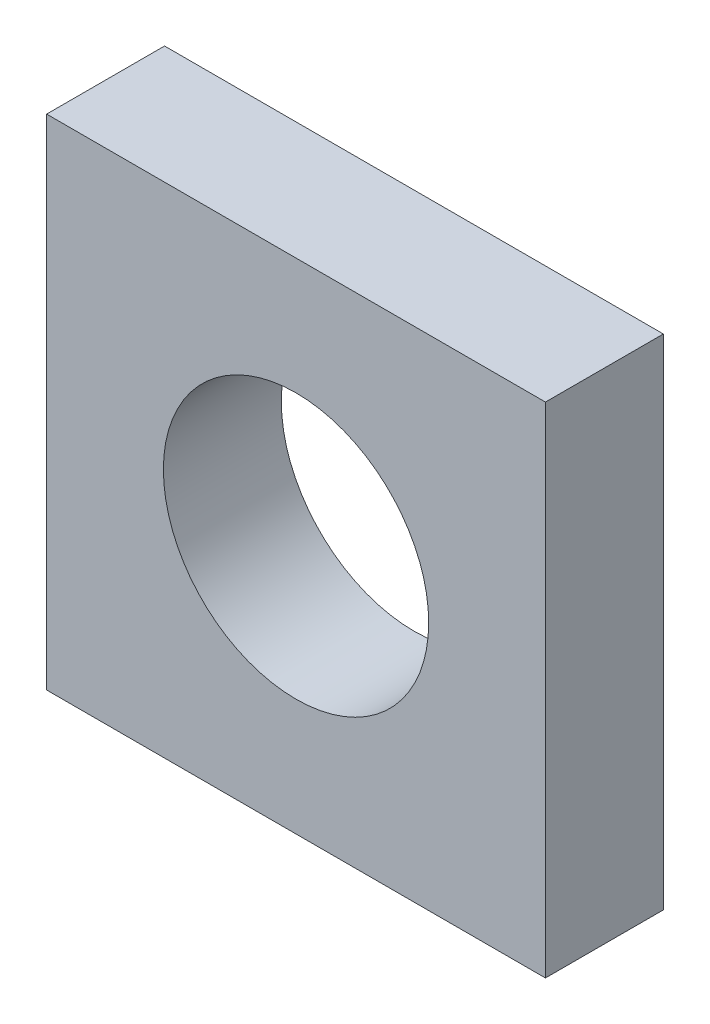
from build123d import *

# Parameters (mm, degrees)
SKETCH1_W           = 42.3
SKETCH1_H           = 42.3
SKETCH1_R           = 11.25
BOSS_EXTRUDE1_DEPTH = 10


with BuildPart() as part:
    # Sketch1 → Boss-Extrude1 (new body)
    with BuildSketch(Plane.XY):
        Rectangle(SKETCH1_W, SKETCH1_H)
        Circle(SKETCH1_R, mode=Mode.SUBTRACT)
    extrude(amount=BOSS_EXTRUDE1_DEPTH)


solid = part.part
